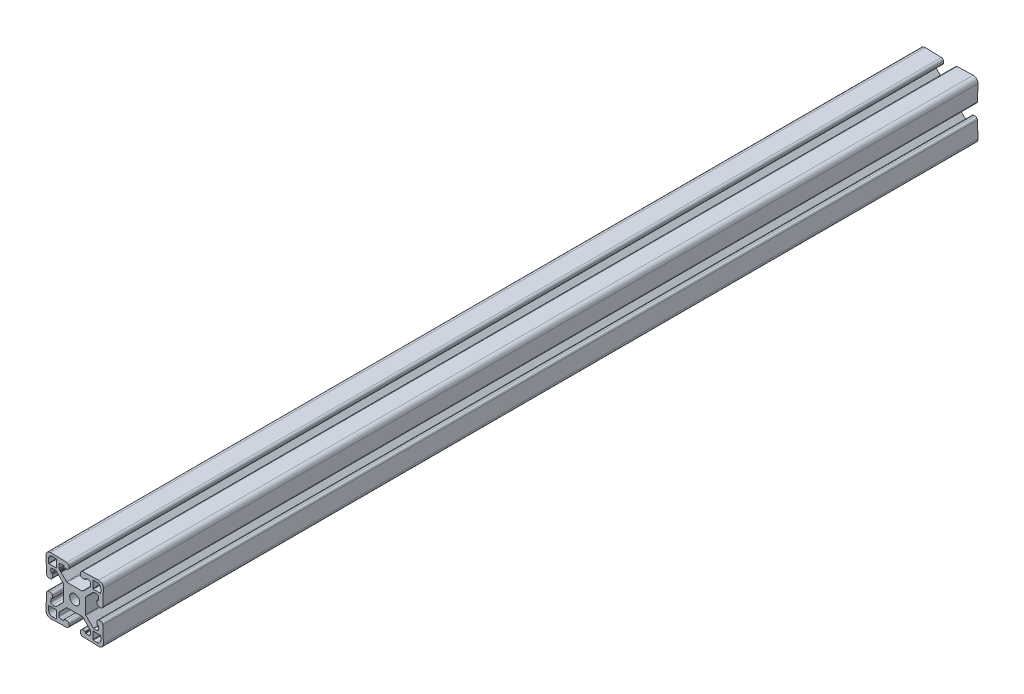
from build123d import *

# Parameters (mm, degrees)
BOSS_EXTRUDE1_DEPTH     = 304.8
CIRPATTERN1_COUNT       = 4
CUT_EXTRUDE1_DEPTH      = 307.109522884
CUT_EXTRUDE1_DEPTH_BACK = 307.109522884


with BuildPart() as part:
    # Sketch3 → Boss-Extrude1 (new, symmetric)
    with BuildSketch(Plane.XY):
        with BuildLine():
            Line((-7.681, 0), (-7.681, 5.210107796))
            ThreePointArc((-7.681, 5.210107796), (-7.739003796, 5.501712572), (-7.904184633, 5.748923164))
            Line((-7.904184633, 5.748923164), (-13.062267872, 10.907006403))
            ThreePointArc((-13.062267872, 10.907006403), (-13.165272285, 10.975831752), (-13.286774275, 11))
            Line((-13.286774275, 11), (-15.433540431, 11))
            ThreePointArc((-15.433540431, 11), (-16.347101978, 10.61221613), (-16.702766782, 9.685677639))
            Line((-16.702766782, 9.685677639), (-16.637141638, 7.80641941))
            ThreePointArc((-16.637141638, 7.80641941), (-16.540389083, 7.589109613), (-16.319835051, 7.5))
            Line((-16.319835051, 7.5), (-15.916428126, 7.5))
            ThreePointArc((-15.916428126, 7.5), (-15.695874093, 7.410890387), (-15.599121538, 7.19358059))
            Line((-15.599121538, 7.19358059), (-15.544946893, 5.642221732))
            ThreePointArc((-15.544946893, 5.642221732), (-15.972024709, 4.529645985), (-17.069017904, 4.064))
            Line((-17.069017904, 4.064), (-18.083635982, 4.064))
            ThreePointArc((-18.083635982, 4.064), (-19.142989997, 4.492006804), (-19.607706993, 5.535778268))
            Line((-19.607706993, 5.535778268), (-19.998065876, 16.714194098))
            ThreePointArc((-19.998065876, 16.714194098), (-19.07006403, 19.07006403), (-16.714194098, 19.998065876))
            Line((-16.714194098, 19.998065876), (-5.535778268, 19.607706993))
            ThreePointArc((-5.535778268, 19.607706993), (-4.492006804, 19.142989997), (-4.064, 18.083635982))
            Line((-4.064, 18.083635982), (-4.064, 17.069017904))
            ThreePointArc((-4.064, 17.069017904), (-4.529645985, 15.972024709), (-5.642221732, 15.544946893))
            Line((-5.642221732, 15.544946893), (-7.19358059, 15.599121538))
            ThreePointArc((-7.19358059, 15.599121538), (-7.410890387, 15.695874093), (-7.5, 15.916428126))
            Line((-7.5, 15.916428126), (-7.5, 16.319835051))
            ThreePointArc((-7.5, 16.319835051), (-7.589109613, 16.540389083), (-7.80641941, 16.637141638))
            Line((-7.80641941, 16.637141638), (-9.685677639, 16.702766782))
            ThreePointArc((-9.685677639, 16.702766782), (-10.61221613, 16.347101978), (-11, 15.433540431))
            Line((-11, 15.433540431), (-11, 13.286774275))
            ThreePointArc((-11, 13.286774275), (-10.975831752, 13.165272285), (-10.907006403, 13.062267872))
            Line((-10.907006403, 13.062267872), (-5.748923164, 7.904184633))
            ThreePointArc((-5.748923164, 7.904184633), (-5.501712572, 7.739003796), (-5.210107796, 7.681))
            Line((-5.210107796, 7.681), (0, 7.681))
            Line((0, 7.681), (0, 3.5))
            ThreePointArc((0, 3.5), (-2.474873734, 2.474873734), (-3.5, 0))
            Line((-3.5, 0), (-7.681, 0))
        make_face()
        with BuildLine():
            Line((-18.220706879, 15.330899714), (-18.136032248, 12.906135528))
            ThreePointArc((-18.136032248, 12.906135528), (-18.058630204, 12.732287691), (-17.882186978, 12.661))
            Line((-17.882186978, 12.661), (-12.915, 12.661))
            ThreePointArc((-12.915, 12.661), (-12.735394878, 12.735394878), (-12.661, 12.915))
            Line((-12.661, 12.915), (-12.661, 17.882186978))
            ThreePointArc((-12.661, 17.882186978), (-12.732287691, 18.058630204), (-12.906135528, 18.136032248))
            Line((-12.906135528, 18.136032248), (-15.330899714, 18.220706879))
            ThreePointArc((-15.330899714, 18.220706879), (-17.404065255, 17.404065255), (-18.220706879, 15.330899714))
        make_face(mode=Mode.SUBTRACT)
    boss_extrude1 = extrude(amount=BOSS_EXTRUDE1_DEPTH, both=True)

    # CirPattern1: Boss-Extrude1 ×4 about axis
    cirpattern1_axis = Axis((0, 0, 304.8), (0, 0, -1))
    for i in range(1, CIRPATTERN1_COUNT):
        add(boss_extrude1.rotate(cirpattern1_axis, i * 360 / CIRPATTERN1_COUNT))

    # Sketch4 → Cut-Extrude1 (cut, two sides: drawn at the far end of the back side and taken through both)
    with BuildSketch(Plane.XY.offset(-CUT_EXTRUDE1_DEPTH_BACK)):
        Polygon((-10.505738531, 12.661), (-9.505738531, 12.661), (-9.505738531, 11.661), (-9.839071864, 11.661), (-9.839071864, 11.994333333), (-10.172405198, 12.327666667), (-10.505738531, 12.327666667), align=None)
    extrude(amount=CUT_EXTRUDE1_DEPTH + CUT_EXTRUDE1_DEPTH_BACK, mode=Mode.SUBTRACT)


solid = part.part
